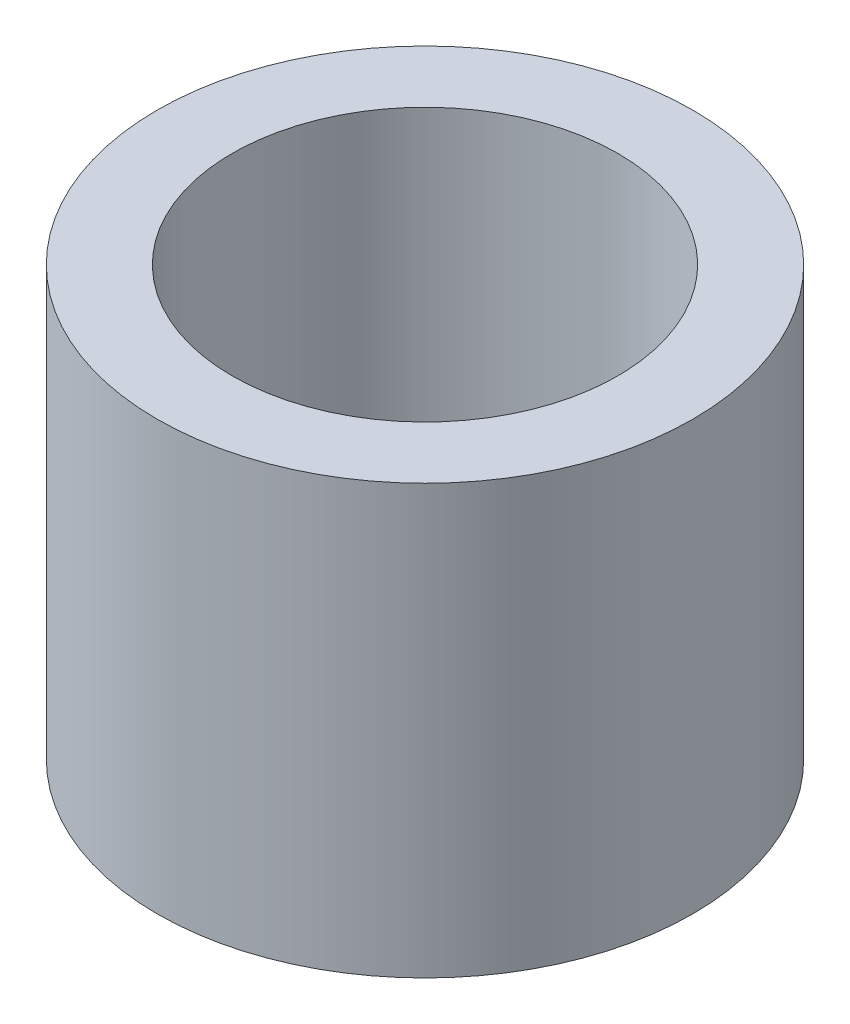
from build123d import *

# Parameters (mm, degrees)
SKETCH1_R           = 3.175
BOSS_EXTRUDE1_DEPTH = 5.08
SKETCH3_R           = 2.286
CUT_EXTRUDE1_DEPTH  = 5.08


with BuildPart() as part:
    # Sketch1 → Boss-Extrude1 (new body)
    with BuildSketch(Plane(origin=(0, 0, 0), x_dir=(1, 0, 0), z_dir=(0, 1, 0))):
        Circle(SKETCH1_R)
    extrude(amount=BOSS_EXTRUDE1_DEPTH)

    # Sketch3 → Cut-Extrude1 (cut)
    with BuildSketch(Plane.XZ):
        Circle(SKETCH3_R)
    extrude(amount=-CUT_EXTRUDE1_DEPTH, mode=Mode.SUBTRACT)


solid = part.part
